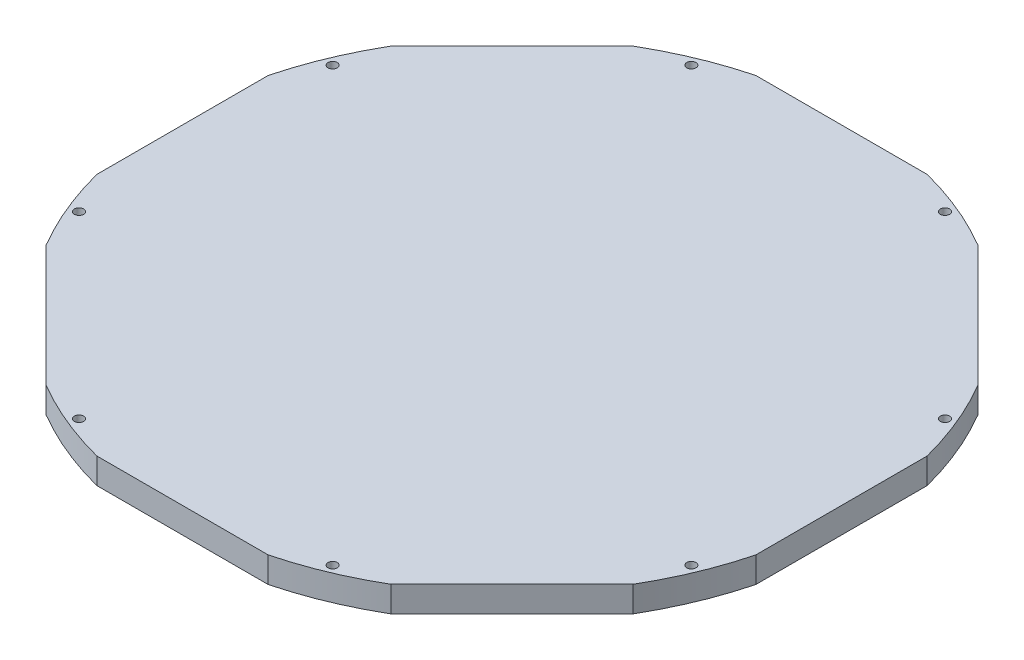
from build123d import *

# Parameters (mm, degrees)
BOSS_EXTRUDE1_DEPTH   = 9.525
SKETCH2_R             = 119.0625
SKETCH2_R_2           = 115.2525
CUT_EXTRUDE1_DEPTH    = 2.667
F_8_32_TAPPED_HOLE1_D = 3.4544
CIRPATTERN1_COUNT     = 8


with BuildPart() as part:
    # Sketch1 → Boss-Extrude1 (new body)
    with BuildSketch(Plane(origin=(0, 0, 0), x_dir=(1, 0, 0), z_dir=(0, 1, 0))):
        with BuildLine():
            ThreePointArc((-31.793446259, 122.3), (-48.357791931, 116.746037126), (-63.997797892, 108.960520786))
            Line((-63.997797892, 108.960520786), (-108.960520786, 63.997797892))
            ThreePointArc((-108.960520786, 63.997797892), (-116.746037126, 48.357791931), (-122.3, 31.793446259))
            Line((-122.3, 31.793446259), (-122.3, -31.793446259))
            ThreePointArc((-122.3, -31.793446259), (-116.746037126, -48.357791931), (-108.960520786, -63.997797892))
            Line((-108.960520786, -63.997797892), (-63.997797892, -108.960520786))
            ThreePointArc((-63.997797892, -108.960520786), (-48.357791931, -116.746037126), (-31.793446259, -122.3))
            Line((-31.793446259, -122.3), (31.793446259, -122.3))
            ThreePointArc((31.793446259, -122.3), (48.357791931, -116.746037126), (63.997797892, -108.960520786))
            Line((63.997797892, -108.960520786), (108.960520786, -63.997797892))
            ThreePointArc((108.960520786, -63.997797892), (116.746037126, -48.357791931), (122.3, -31.793446259))
            Line((122.3, -31.793446259), (122.3, 31.793446259))
            ThreePointArc((122.3, 31.793446259), (116.746037126, 48.357791931), (108.960520786, 63.997797892))
            Line((108.960520786, 63.997797892), (63.997797892, 108.960520786))
            ThreePointArc((63.997797892, 108.960520786), (48.357791931, 116.746037126), (31.793446259, 122.3))
            Line((31.793446259, 122.3), (-31.793446259, 122.3))
        make_face()
    extrude(amount=BOSS_EXTRUDE1_DEPTH)

    # Sketch2 → Cut-Extrude1 (cut)
    with BuildSketch(Plane.XZ):
        Circle(SKETCH2_R)
        Circle(SKETCH2_R_2, mode=Mode.SUBTRACT)
    extrude(amount=-CUT_EXTRUDE1_DEPTH, mode=Mode.SUBTRACT)

    # #8-32 Tapped Hole1 (through all)
    with Locations(Plane(origin=(0, 9.525, 0), x_dir=(1, 0, 0), z_dir=(0, 1, 0))):
        with Locations((-47.069870839, 113.636720559)):
            f_8_32_tapped_hole1 = Hole(F_8_32_TAPPED_HOLE1_D / 2)

    # CirPattern1: #8-32 Tapped Hole1 ×8 about axis
    cirpattern1_axis = Axis((0, 9.525, 0), (0, -1, 0))
    for i in range(1, CIRPATTERN1_COUNT):
        add(f_8_32_tapped_hole1.rotate(cirpattern1_axis, i * 360 / CIRPATTERN1_COUNT), mode=Mode.SUBTRACT)


solid = part.part
